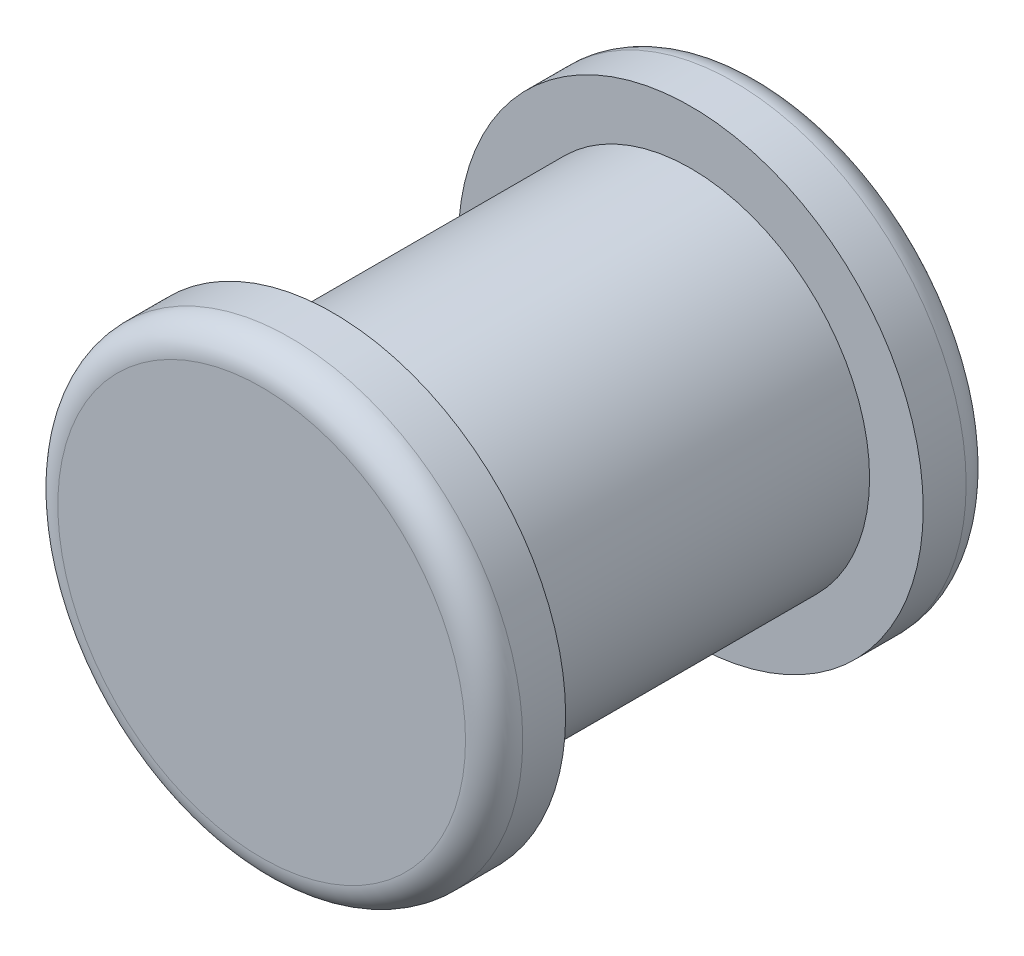
from build123d import *

# Parameters (mm, degrees)
SKETCH1_R           = 250
BOSS_EXTRUDE1_DEPTH = 500
SKETCH2_R           = 325
BOSS_EXTRUDE2_DEPTH = 100
BOSS_EXTRUDE3_START = 100
SKETCH3_R           = 325
BOSS_EXTRUDE3_DEPTH = 100
FILLET1_R           = 40


with BuildPart() as part:
    # Sketch1 → Boss-Extrude1 (new body)
    with BuildSketch(Plane.XY):
        Circle(SKETCH1_R)
    extrude(amount=BOSS_EXTRUDE1_DEPTH)

    # Sketch2 → Boss-Extrude2 (add)
    with BuildSketch(Plane.XY.offset(500)):
        Circle(SKETCH2_R)
    extrude(amount=BOSS_EXTRUDE2_DEPTH)

    # Sketch3 → Boss-Extrude3 (add)
    with BuildSketch(Plane(origin=(0, 0, 0), x_dir=(-1, 0, 0), z_dir=(0, 0, -1)).offset(BOSS_EXTRUDE3_START)):
        Circle(SKETCH3_R)
    extrude(amount=-BOSS_EXTRUDE3_DEPTH)

    # Fillet1
    fillet1_edges = [part.edges().sort_by_distance(p)[0] for p in [
        (-325, 0, 600),
        (325, 0, -100),
    ]]
    fillet(fillet1_edges, radius=FILLET1_R)


solid = part.part
